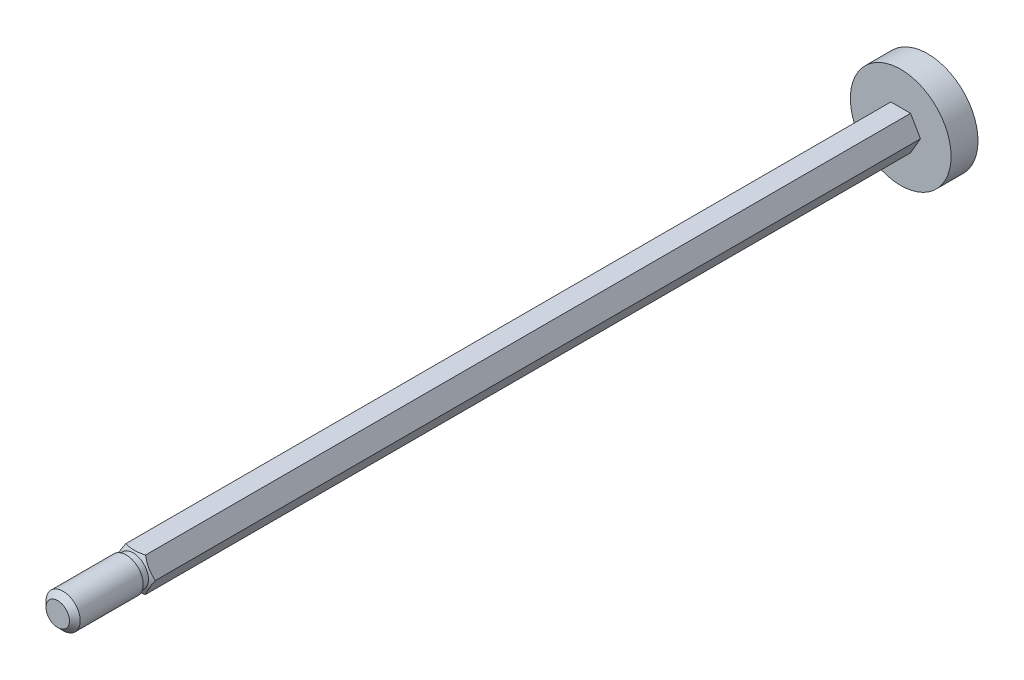
from build123d import *

# Parameters (mm, degrees)
SKETCH1_R          = 9.35
PISTON_DEPTH       = 2.5
ROD_DEPTH          = 159.0119
SKETCH4_R          = 9.35
SKETCH4_R_2        = 3.175
THREAD_DEPTH       = 14
CHAMFER1_SIZE      = 1
SKETCH5_W          = 1.3
SKETCH5_H          = 2.54
CUT_REVOLVE1_ANGLE = 180


with BuildPart() as part:
    # Sketch1 → Piston (new, symmetric)
    with BuildSketch(Plane.XY):
        Circle(SKETCH1_R)
    extrude(amount=PISTON_DEPTH, both=True)

    # Sketch2 → Rod (add)
    with BuildSketch(Plane.XY):
        Polygon((3.666174209, 0), (1.833087105, 3.175), (-1.833087105, 3.175), (-3.666174209, 0), (-1.833087105, -3.175), (1.833087105, -3.175), align=None)
    extrude(amount=ROD_DEPTH)

    # Sketch4 → Thread (cut)
    with BuildSketch(Plane.XY.offset(159.0119)):
        Circle(SKETCH4_R)
        with Locations(Location((0, 0, 0), (0, 0, 330))):
            Circle(SKETCH4_R_2, mode=Mode.SUBTRACT)
    extrude(amount=-THREAD_DEPTH, mode=Mode.SUBTRACT)

    # Chamfer1
    chamfer1_edges = [part.edges().sort_by_distance(p)[0] for p in [
        (-2.749630657, 1.5875, 159.0119),
    ]]
    chamfer(chamfer1_edges, length=CHAMFER1_SIZE)

    # Sketch5 → Cut-Revolve1 (revolve, cut)
    with BuildSketch(Plane(origin=(0, 0, 0), x_dir=(0, 0, -1), z_dir=(1, 0, 0))):
        with Locations((-145.6619, 4.12)):
            Rectangle(SKETCH5_W, SKETCH5_H)
        with Locations((-145.6619, -4.12)):
            Rectangle(SKETCH5_W, SKETCH5_H)
    revolve(axis=Axis((0, 0, 47.288533753), (0, 0, 1)), revolution_arc=CUT_REVOLVE1_ANGLE, mode=Mode.SUBTRACT)

    # Sketch6 → Cut-Revolve2 (revolve, cut)
    with BuildSketch(Plane(origin=(0, 0, 0), x_dir=(0, 0, -1), z_dir=(1, 0, 0)), mode=Mode.PRIVATE) as cut_revolve2_sk:
        Polygon((-145.0119, 2.85), (-145.0119, 7.746831352), (-142.184713101, 7.746831352), align=None)
    revolve(cut_revolve2_sk.sketch.rotate(Axis((0, 0, 96.043182271), (0, 0, 1)), 90), axis=Axis((0, 0, 96.043182271), (0, 0, 1)), mode=Mode.SUBTRACT)


solid = part.part
